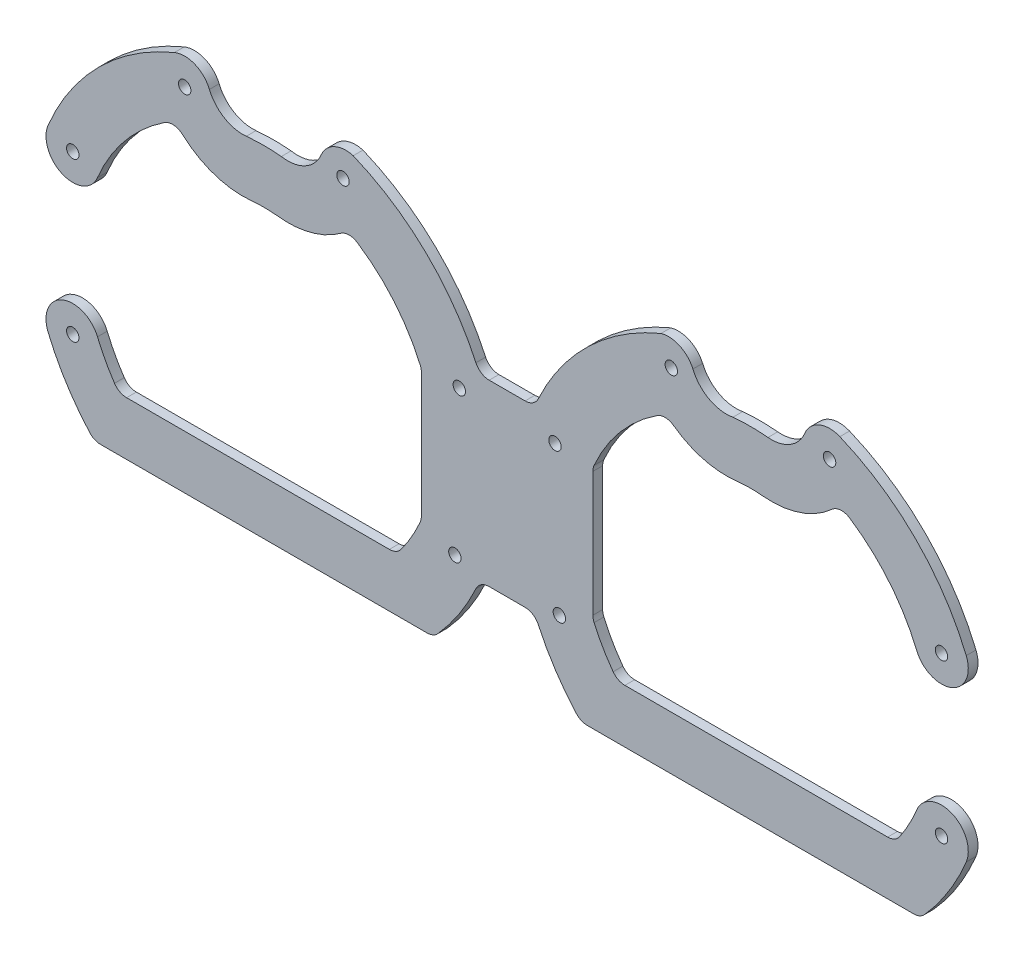
from build123d import *

# Parameters (mm, degrees)
EXTRUDE_1_DEPTH      = 2
HOLE_WIZARD_M2_5_1_D = 2.55
SKETCH_5_OUTSIDE_W   = 241.652
SKETCH_5_OUTSIDE_H   = 141.652
CUT_EXTRUDE_1_DEPTH  = 10
FILLET_1_R           = 3


with BuildPart() as part:
    # 草图1 → 凸台-拉伸1 (new body)
    with BuildSketch(Plane.XY):
        with BuildLine():
            Line((-50, 48), (50, 48))
            ThreePointArc((50, 48), (98, 0), (50, -48))
            Line((50, -48), (-50, -48))
            ThreePointArc((-50, -48), (-98, 0), (-50, 48))
        make_face()
    extrude(amount=EXTRUDE_1_DEPTH)

    # M2.5 螺旋的螺纹孔钻头1 (through all)
    with Locations(Plane(origin=(-89.264880132, 16.264045876, 2), x_dir=(1, 0, 0), z_dir=(0, 0, 1))):
        with Locations((0, 0), (23.000834256, 23.000834256), (55.528926008, 23.000834256), (55.528926008, -55.528926008), (23.000834256, -55.528926008), (0, -32.528091752), (79.433936211, -2.382513767), (78.529760264, -32.528091752), (100, -32.528091752), (99.095824053, -2.382513767), (178.529760264, -32.528091752), (155.528926008, -55.528926008), (123.000834256, -55.528926008), (123.000834256, 23.000834256), (155.528926008, 23.000834256), (178.529760264, 0)):
            Hole(HOLE_WIZARD_M2_5_1_D / 2)

    # 草图5 outside → 切除-拉伸1 (cut)
    with BuildSketch(Plane.XY):
        Rectangle(SKETCH_5_OUTSIDE_W, SKETCH_5_OUTSIDE_H)
        with BuildLine():
            Line((-17.624645737, 13.410310822), (-17.624645737, -13.410310822))
            ThreePointArc((-17.624645737, -13.410310822), (-19.866504602, -17.8877739), (-22.723636606, -22))
            Line((-22.723636606, -22), (-50, -22))
            Line((-50, -22), (-79.748949561, -22))
            ThreePointArc((-79.748949561, -22), (-82.205746178, -18.215101238), (-84.183542703, -14.159286998))
            ThreePointArc((-84.183542703, -14.159286998), (-91.36963901, -11.182708447), (-94.346217561, -18.368804754))
            ThreePointArc((-94.346217561, -18.368804754), (-90.27157125, -26.118969143), (-84.856850116, -33))
            Line((-84.856850116, -33), (-50, -33))
            Line((-50, -33), (-15.143149884, -33))
            ThreePointArc((-15.143149884, -33), (-9.72842875, -26.118969143), (-5.653782439, -18.368804754))
            Line((-5.653782439, -18.368804754), (5.653782439, -18.368804754))
            ThreePointArc((5.653782439, -18.368804754), (9.72842875, -26.118969143), (15.143149884, -33))
            Line((15.143149884, -33), (50, -33))
            Line((50, -33), (84.856850116, -33))
            ThreePointArc((84.856850116, -33), (90.27157125, -26.118969143), (94.346217561, -18.368804754))
            ThreePointArc((94.346217561, -18.368804754), (91.36963901, -11.182708447), (84.183542703, -14.159286998))
            ThreePointArc((84.183542703, -14.159286998), (82.205746178, -18.215101238), (79.748949561, -22))
            Line((79.748949561, -22), (50, -22))
            Line((50, -22), (22.723636606, -22))
            ThreePointArc((22.723636606, -22), (19.866504602, -17.8877739), (17.624645737, -13.410310822))
            Line((17.624645737, -13.410310822), (17.624645737, 13.410310822))
            ThreePointArc((17.624645737, 13.410310822), (23.735615492, 23.19875226), (32.69455003, 30.471649141))
            ThreePointArc((32.69455003, 30.471649141), (39.576020714, 26.5465333), (47.469620511, 25.874033941))
            ThreePointArc((47.469620511, 25.874033941), (50, 25.997470122), (52.530379489, 25.874033941))
            ThreePointArc((52.530379489, 25.874033941), (61.168879724, 27.10538111), (68.271972663, 32.173514185))
            ThreePointArc((68.271972663, 32.173514185), (77.731270587, 24.494420419), (84.183542703, 14.159286998))
            ThreePointArc((84.183542703, 14.159286998), (91.36963901, 11.182708447), (94.346217561, 18.368804754))
            ThreePointArc((94.346217561, 18.368804754), (83.941125497, 33.941125497), (68.368804754, 44.346217561))
            ThreePointArc((68.368804754, 44.346217561), (64.159286998, 44.346217561), (61.182708447, 41.36963901))
            ThreePointArc((61.182708447, 41.36963901), (58.142635011, 37.844121971), (53.601028835, 36.82180586))
            ThreePointArc((53.601028835, 36.82180586), (50, 36.997470122), (46.398971165, 36.82180586))
            ThreePointArc((46.398971165, 36.82180586), (41.496918749, 37.601888369), (38.17643191, 41.291470155))
            ThreePointArc((38.17643191, 41.291470155), (35.475540487, 44.043851175), (31.631195246, 44.346217561))
            ThreePointArc((31.631195246, 44.346217561), (16.058874503, 33.941125497), (5.653782439, 18.368804754))
            Line((5.653782439, 18.368804754), (-5.653782439, 18.368804754))
            ThreePointArc((-5.653782439, 18.368804754), (-16.058874503, 33.941125497), (-31.631195246, 44.346217561))
            ThreePointArc((-31.631195246, 44.346217561), (-35.475540487, 44.043851175), (-38.17643191, 41.291470155))
            ThreePointArc((-38.17643191, 41.291470155), (-41.496918749, 37.601888369), (-46.398971165, 36.82180586))
            ThreePointArc((-46.398971165, 36.82180586), (-50, 36.997470122), (-53.601028835, 36.82180586))
            ThreePointArc((-53.601028835, 36.82180586), (-58.142635011, 37.844121971), (-61.182708447, 41.36963901))
            ThreePointArc((-61.182708447, 41.36963901), (-64.159286998, 44.346217561), (-68.368804754, 44.346217561))
            ThreePointArc((-68.368804754, 44.346217561), (-83.941125497, 33.941125497), (-94.346217561, 18.368804754))
            ThreePointArc((-94.346217561, 18.368804754), (-91.36963901, 11.182708447), (-84.183542703, 14.159286998))
            ThreePointArc((-84.183542703, 14.159286998), (-77.731270587, 24.494420419), (-68.271972663, 32.173514185))
            ThreePointArc((-68.271972663, 32.173514185), (-61.168879724, 27.10538111), (-52.530379489, 25.874033941))
            ThreePointArc((-52.530379489, 25.874033941), (-50, 25.997470122), (-47.469620511, 25.874033941))
            ThreePointArc((-47.469620511, 25.874033941), (-39.576020714, 26.5465333), (-32.69455003, 30.471649141))
            ThreePointArc((-32.69455003, 30.471649141), (-23.735615492, 23.19875226), (-17.624645737, 13.410310822))
        make_face(mode=Mode.SUBTRACT)
    extrude(amount=CUT_EXTRUDE_1_DEPTH, mode=Mode.SUBTRACT)

    # 圆角1
    fillet_1_edges = [part.edges().sort_by_distance(p)[0] for p in [
        (68.271972663, 32.173514185, 1),
        (32.69455003, 30.471649141, 1),
        (17.624645737, 13.410310822, 1),
        (17.624645737, -13.410310822, 1),
        (22.723636606, -22, 1),
        (79.748949561, -22, 1),
        (84.856850116, -33, 1),
        (15.143149884, -33, 1),
        (-5.653782439, -18.368804754, 1),
        (5.653782439, -18.368804754, 1),
        (5.653782439, 18.368804754, 1),
        (-5.653782439, 18.368804754, 1),
        (-15.143149884, -33, 1),
        (-79.748949561, -22, 1),
        (-22.723636606, -22, 1),
        (-17.624645737, -13.410310822, 1),
        (-17.624645737, 13.410310822, 1),
        (-32.69455003, 30.471649141, 1),
        (-68.271972663, 32.173514185, 1),
        (-84.856850116, -33, 1),
    ]]
    fillet(fillet_1_edges, radius=FILLET_1_R)


solid = part.part
